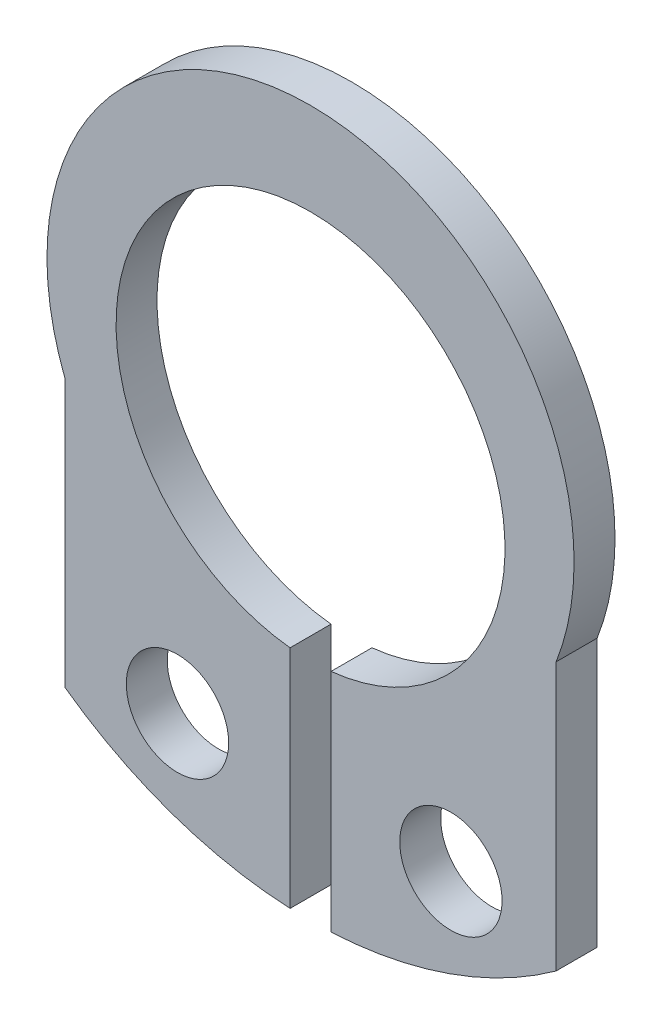
from build123d import *

# Parameters (mm, degrees)
ESQUISSE1_R        = 0.5
BOSS_EXTRU_1_DEPTH = 0.4


with BuildPart() as part:
    # Esquisse1 → Boss.-Extru.1 (new body)
    with BuildSketch(Plane(origin=(0, 0, 0), x_dir=(-1, 0, 0), z_dir=(0, 0, -1))):
        with BuildLine():
            Line((0.092682927, 0.307936589), (0.092682927, -1.897738094))
            ThreePointArc((0.092682927, -1.897738094), (1.248631585, -1.671908807), (2.292682927, -1.126773076))
            Line((2.292682927, -1.126773076), (2.292682927, 1.489308071))
            ThreePointArc((2.292682927, 1.489308071), (-0.107317073, 4.997380951), (-2.507317073, 1.489308071))
            Line((-2.507317073, 1.489308071), (-2.507317073, -1.126773076))
            ThreePointArc((-2.507317073, -1.126773076), (-1.463265732, -1.671908807), (-0.307317073, -1.897738094))
            Line((-0.307317073, -1.897738094), (-0.307317073, 0.307936589))
            ThreePointArc((-0.307317073, 0.307936589), (-0.107317073, 4.097380951), (0.092682927, 0.307936589))
        make_face()
        with Locations((1.192682927, -0.797738094)):
            Circle(ESQUISSE1_R, mode=Mode.SUBTRACT)
        with Locations((-1.478745645, -0.797738094)):
            Circle(ESQUISSE1_R, mode=Mode.SUBTRACT)
    extrude(amount=-BOSS_EXTRU_1_DEPTH)


solid = part.part
